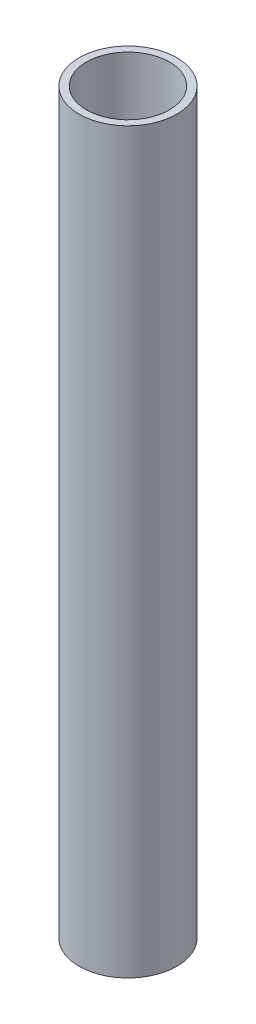
from build123d import *

# Parameters (mm, degrees)
SKETCH1_R           = 3.975
BOSS_EXTRUDE1_DEPTH = 60
SKETCH2_R           = 3.375
CUT_EXTRUDE1_DEPTH  = 36.448571904
CUT_EXTRUDE2_DEPTH  = 61.262768357
SKETCH7_R           = 2.7
CUT_EXTRUDE3_DEPTH  = 23


with BuildPart() as part:
    # Sketch1 → Boss-Extrude1 (new body)
    with BuildSketch(Plane(origin=(0, 0, 0), x_dir=(1, 0, 0), z_dir=(0, 1, 0))):
        Circle(SKETCH1_R)
    extrude(amount=BOSS_EXTRUDE1_DEPTH)

    # Sketch2 → Cut-Extrude1 (cut, through all)
    with BuildSketch(Plane(origin=(0, 25, 0), x_dir=(1, 0, 0), z_dir=(0, 1, 0))):
        Circle(SKETCH2_R)
    extrude(amount=CUT_EXTRUDE1_DEPTH, mode=Mode.SUBTRACT)

    # Sketch3 → Cut-Extrude2 (cut, through all)
    with BuildSketch(Plane(origin=(0, 0, 0), x_dir=(0, 0, -1), z_dir=(1, 0, 0))):
        with BuildLine():
            Line((-2.475, 27.475), (-2.475, 31))
            ThreePointArc((-2.475, 31), (0, 33.475), (2.475, 31))
            Line((2.475, 31), (2.475, 27.475))
            ThreePointArc((2.475, 27.475), (0, 25), (-2.475, 27.475))
        make_face()
    extrude(amount=-CUT_EXTRUDE2_DEPTH, mode=Mode.SUBTRACT)

    # Sketch7 → Cut-Extrude3 (cut)
    with BuildSketch(Plane(origin=(0, 0, 0), x_dir=(1, 0, 0), z_dir=(0, 1, 0))):
        Circle(SKETCH7_R)
    extrude(amount=CUT_EXTRUDE3_DEPTH, mode=Mode.SUBTRACT)


solid = part.part
